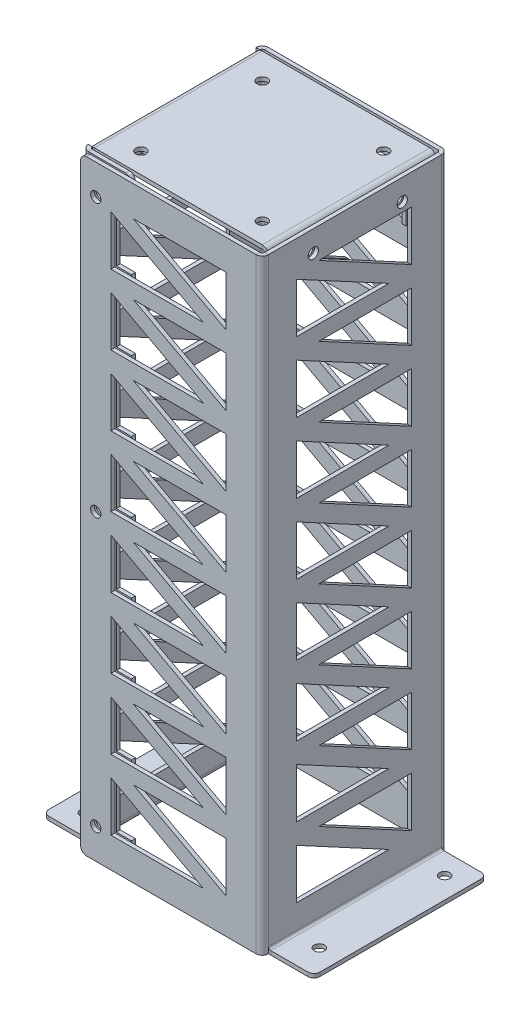
from build123d import *

# Parameters (mm, degrees)
SKETCH2_W                        = 60
SKETCH2_H                        = 200
BASE_FLANGE1_DEPTH               = 1.29
EDGE_FLANGE1_STRIP_W             = 6.684
EDGE_FLANGE1_STRIP_H             = 1.29
EDGE_FLANGE1_STRIP_CUT_DEPTH     = 200
EDGE_FLANGE1_DEPTH               = 200
EDGE_FLANGE2_STRIP_W             = 6.684
EDGE_FLANGE2_STRIP_H             = 1.29
EDGE_FLANGE2_STRIP_CUT_DEPTH     = 200
EDGE_FLANGE2_DEPTH               = 200
EDGE_FLANGE3_STRIP_W             = 6.684
EDGE_FLANGE3_STRIP_H             = 1.29
EDGE_FLANGE3_STRIP_CUT_DEPTH     = 200
EDGE_FLANGE3_DEPTH               = 200
EDGE_FLANGE4_STRIP_W             = 6.684
EDGE_FLANGE4_STRIP_H             = 1.29
EDGE_FLANGE4_STRIP_CUT_DEPTH     = 200
EDGE_FLANGE4_DEPTH               = 200
EDGE_FLANGE5_STRIP_W             = 6.684
EDGE_FLANGE5_STRIP_H             = 1.29
EDGE_FLANGE5_STRIP_CUT_DEPTH     = 57.186
EDGE_FLANGE5_DEPTH               = 57.186
EDGE_FLANGE6_STRIP_W             = 6.684
EDGE_FLANGE6_STRIP_H             = 1.29
EDGE_FLANGE6_STRIP_CUT_DEPTH     = 55.396
EDGE_FLANGE6_DEPTH               = 55.396
EDGE_FLANGE8_STRIP_W             = 6.684
EDGE_FLANGE8_STRIP_H             = 1.29
EDGE_FLANGE8_STRIP_CUT_DEPTH     = 55.396
EDGE_FLANGE8_DEPTH               = 55.396
EDGE_FLANGE9_START               = -59.238
EDGE_FLANGE9_DEPTH               = 55.396
EDGE_FLANGE9_2_DEPTH             = 55.396
SPEED_HOLE_DEPTH                 = 223.219405318
SPEED_HOLES_COUNT                = 8
SPEED_HOLES_PITCH                = 23.13
COPY_OF_SPEED_HOLES_COUNT        = 2
COPY_OF_SPEED_HOLES_ANGLE        = 90
COPY_OF_SPEED_HOLES_COPY_1_DEPTH = 223.219405318
COPY_OF_SPEED_HOLES_COPY_2_DEPTH = 223.219405318
COPY_OF_SPEED_HOLES_COPY_3_DEPTH = 223.219405318
COPY_OF_SPEED_HOLES_COPY_4_DEPTH = 223.219405318
COPY_OF_SPEED_HOLES_COPY_5_DEPTH = 223.219405318
COPY_OF_SPEED_HOLES_COPY_6_DEPTH = 223.219405318
COPY_OF_SPEED_HOLES_COPY_7_DEPTH = 223.219405318
M3_CLEARANCE_HOLE1_AT_2_COUNT    = 2
M3_CLEARANCE_HOLE1_AT_2_PITCH    = 41.396
M3_CLEARANCE_HOLE2_D             = 3.4
M3_START                         = -3.08
M3_CLEARANCE_HOLE3_OUTLINE_R     = 1.7
M3_CLEARANCE_HOLE3_DEPTH         = 3.08
M3_START_2                       = 56.92
M3_CLEARANCE_HOLE4_OUTLINE_R     = 1.7
M3_CLEARANCE_HOLE4_DEPTH         = 3.08
FILLET1_R                        = 2


# Read off the part's stored shape, not the designer's step: Edge-Flange9, M3 Clearance Hole3, M3 Clearance Hole4
# Sheet-metal steps are written as plain solids
with BuildPart() as part:
    # Sketch2 → Base-Flange1 (new body)
    with BuildSketch(Plane.XY):
        with Locations((30, 100)):
            Rectangle(SKETCH2_W, SKETCH2_H)
    extrude(amount=-BASE_FLANGE1_DEPTH)

    # Edge-Flange1 strip (across the edge) → Edge-Flange1 strip cut (cut)
    with BuildSketch(Plane(origin=(60, 200, -1.29), x_dir=(-1, 0, 0), z_dir=(0, -1, 0))):
        with Locations((-1.29, -0.645)):
            Rectangle(EDGE_FLANGE1_STRIP_W, EDGE_FLANGE1_STRIP_H)
    extrude(amount=EDGE_FLANGE1_STRIP_CUT_DEPTH, mode=Mode.SUBTRACT)

    # Edge-Flange1 section (across the edge) → Edge-Flange1 (add)
    with BuildSketch(Plane(origin=(60, 200, -1.29), x_dir=(-1, 0, 0), z_dir=(0, -1, 0))):
        with BuildLine():
            Line((0, 0.762), (0, 60))
            Line((0, 60), (1.29, 60))
            Line((1.29, 60), (1.29, 0.762))
            ThreePointArc((1.29, 0.762), (1.513184633, 0.223184633), (2.052, 0))
            Line((2.052, 0), (2.052, -1.29))
            ThreePointArc((2.052, -1.29), (0.601016885, -0.688983115), (0, 0.762))
        make_face()
    extrude(amount=EDGE_FLANGE1_DEPTH)

    # Edge-Flange2 strip (across the edge) → Edge-Flange2 strip cut (cut)
    with BuildSketch(Plane(origin=(58.71, 200, -61.29), x_dir=(0, 0, 1), z_dir=(0, -1, 0))):
        with Locations((-1.29, -0.645)):
            Rectangle(EDGE_FLANGE2_STRIP_W, EDGE_FLANGE2_STRIP_H)
    extrude(amount=EDGE_FLANGE2_STRIP_CUT_DEPTH, mode=Mode.SUBTRACT)

    # Edge-Flange2 section (across the edge) → Edge-Flange2 (add)
    with BuildSketch(Plane(origin=(58.71, 200, -61.29), x_dir=(0, 0, 1), z_dir=(0, -1, 0))):
        with BuildLine():
            Line((0, 0.762), (0, 60))
            Line((0, 60), (1.29, 60))
            Line((1.29, 60), (1.29, 0.762))
            ThreePointArc((1.29, 0.762), (1.513184633, 0.223184633), (2.052, 0))
            Line((2.052, 0), (2.052, -1.29))
            ThreePointArc((2.052, -1.29), (0.601016885, -0.688983115), (0, 0.762))
        make_face()
    extrude(amount=EDGE_FLANGE2_DEPTH)

    # Edge-Flange3 strip (across the edge) → Edge-Flange3 strip cut (cut)
    with BuildSketch(Plane(origin=(-1.29, 200, -60), x_dir=(1, 0, 0), z_dir=(0, -1, 0))):
        with Locations((-1.29, -0.645)):
            Rectangle(EDGE_FLANGE3_STRIP_W, EDGE_FLANGE3_STRIP_H)
    extrude(amount=EDGE_FLANGE3_STRIP_CUT_DEPTH, mode=Mode.SUBTRACT)

    # Edge-Flange3 section (across the edge) → Edge-Flange3 (add)
    with BuildSketch(Plane(origin=(-1.29, 200, -60), x_dir=(1, 0, 0), z_dir=(0, -1, 0))):
        with BuildLine():
            Line((0, 0.762), (0, 58.21))
            Line((0, 58.21), (1.29, 58.21))
            Line((1.29, 58.21), (1.29, 0.762))
            ThreePointArc((1.29, 0.762), (1.513184633, 0.223184633), (2.052, 0))
            Line((2.052, 0), (2.052, -1.29))
            ThreePointArc((2.052, -1.29), (0.601016885, -0.688983115), (0, 0.762))
        make_face()
    extrude(amount=EDGE_FLANGE3_DEPTH)

    # Edge-Flange4 strip (across the edge) → Edge-Flange4 strip cut (cut)
    with BuildSketch(Plane(origin=(0, 200, -1.79), x_dir=(0, 0, -1), z_dir=(0, -1, 0))):
        with Locations((-1.29, -0.645)):
            Rectangle(EDGE_FLANGE4_STRIP_W, EDGE_FLANGE4_STRIP_H)
    extrude(amount=EDGE_FLANGE4_STRIP_CUT_DEPTH, mode=Mode.SUBTRACT)

    # Edge-Flange4 section (across the edge) → Edge-Flange4 (add)
    with BuildSketch(Plane(origin=(0, 200, -1.79), x_dir=(0, 0, -1), z_dir=(0, -1, 0))):
        with BuildLine():
            Line((0, 0.762), (0, 15))
            Line((0, 15), (1.29, 15))
            Line((1.29, 15), (1.29, 0.762))
            ThreePointArc((1.29, 0.762), (1.513184633, 0.223184633), (2.052, 0))
            Line((2.052, 0), (2.052, -1.29))
            ThreePointArc((2.052, -1.29), (0.601016885, -0.688983115), (0, 0.762))
        make_face()
    extrude(amount=EDGE_FLANGE4_DEPTH)

    # Edge-Flange5 strip (across the edge) → Edge-Flange5 strip cut (cut)
    with BuildSketch(Plane(origin=(60, 0, -2.052), x_dir=(0, 1, 0), z_dir=(0, 0, -1))):
        with Locations((-1.29, -0.645)):
            Rectangle(EDGE_FLANGE5_STRIP_W, EDGE_FLANGE5_STRIP_H)
    extrude(amount=EDGE_FLANGE5_STRIP_CUT_DEPTH, mode=Mode.SUBTRACT)

    # Edge-Flange5 section (across the edge) → Edge-Flange5 (add)
    with BuildSketch(Plane(origin=(60, 0, -2.052), x_dir=(0, 1, 0), z_dir=(0, 0, -1))):
        with BuildLine():
            Line((0, 0.762), (0, 15))
            Line((0, 15), (1.29, 15))
            Line((1.29, 15), (1.29, 0.762))
            ThreePointArc((1.29, 0.762), (1.513184633, 0.223184633), (2.052, 0))
            Line((2.052, 0), (2.052, -1.29))
            ThreePointArc((2.052, -1.29), (0.601016885, -0.688983115), (0, 0.762))
        make_face()
    extrude(amount=EDGE_FLANGE5_DEPTH)

    # Edge-Flange6 strip (across the edge) → Edge-Flange6 strip cut (cut)
    with BuildSketch(Plane(origin=(-1.29, 0, -59.238), x_dir=(0, 1, 0), z_dir=(0, 0, 1))):
        with Locations((-1.29, -0.645)):
            Rectangle(EDGE_FLANGE6_STRIP_W, EDGE_FLANGE6_STRIP_H)
    extrude(amount=EDGE_FLANGE6_STRIP_CUT_DEPTH, mode=Mode.SUBTRACT)

    # Edge-Flange6 section (across the edge) → Edge-Flange6 (add)
    with BuildSketch(Plane(origin=(-1.29, 0, -59.238), x_dir=(0, 1, 0), z_dir=(0, 0, 1))):
        with BuildLine():
            Line((0, 0.762), (0, 15))
            Line((0, 15), (1.29, 15))
            Line((1.29, 15), (1.29, 0.762))
            ThreePointArc((1.29, 0.762), (1.513184633, 0.223184633), (2.052, 0))
            Line((2.052, 0), (2.052, -1.29))
            ThreePointArc((2.052, -1.29), (0.601016885, -0.688983115), (0, 0.762))
        make_face()
    extrude(amount=EDGE_FLANGE6_DEPTH)

    # Edge-Flange8 strip (across the edge) → Edge-Flange8 strip cut (cut)
    with BuildSketch(Plane(origin=(0, 200, -59.238), x_dir=(0, -1, 0), z_dir=(0, 0, 1))):
        with Locations((-1.29, -0.645)):
            Rectangle(EDGE_FLANGE8_STRIP_W, EDGE_FLANGE8_STRIP_H)
    extrude(amount=EDGE_FLANGE8_STRIP_CUT_DEPTH, mode=Mode.SUBTRACT)

    # Edge-Flange8 section (across the edge) → Edge-Flange8 (add)
    with BuildSketch(Plane(origin=(0, 200, -59.238), x_dir=(0, -1, 0), z_dir=(0, 0, 1))):
        with BuildLine():
            Line((0, 0.762), (0, 58.21))
            Line((0, 58.21), (1.29, 58.21))
            Line((1.29, 58.21), (1.29, 0.762))
            ThreePointArc((1.29, 0.762), (1.513184633, 0.223184633), (2.052, 0))
            Line((2.052, 0), (2.052, -1.29))
            ThreePointArc((2.052, -1.29), (0.601016885, -0.688983115), (0, 0.762))
        make_face()
    extrude(amount=EDGE_FLANGE8_DEPTH)

    # Edge-Flange9 outline → Edge-Flange9 (cut)
    with BuildSketch(Plane.XY.offset(EDGE_FLANGE9_START)):
        with BuildLine():
            ThreePointArc((56.158, 200), (57.308452085, 199.647165678), (58.063271634, 198.71))
            Line((58.063271634, 198.71), (58.21, 198.71))
            Line((58.21, 198.71), (58.21, 200))
            Line((58.21, 200), (56.158, 200))
        make_face()
    extrude(amount=EDGE_FLANGE9_DEPTH, mode=Mode.SUBTRACT)

    # Edge-Flange9 2 outline → Edge-Flange9 2 (add)
    with BuildSketch(Plane.XY.offset(EDGE_FLANGE9_START)):
        with BuildLine():
            Line((58.21, 183.71), (58.21, 197.948))
            ThreePointArc((58.21, 197.948), (58.172984044, 198.335999102), (58.063271634, 198.71))
            Line((58.063271634, 198.71), (56.158, 198.71))
            ThreePointArc((56.158, 198.71), (56.696815367, 198.486815367), (56.92, 197.948))
            Line((56.92, 197.948), (56.92, 183.71))
            Line((56.92, 183.71), (58.21, 183.71))
        make_face()
    extrude(amount=EDGE_FLANGE9_2_DEPTH)

    # Sketch37 → Speed Hole (cut, through all)
    with BuildSketch(Plane.XY):
        Polygon((47.948, 190), (17.416327699, 190), (47.948, 173.56047029), align=None)
        Polygon((40.531672301, 171.875), (10, 188.31452971), (10, 171.875), align=None)
    speed_hole = extrude(amount=-SPEED_HOLE_DEPTH, mode=Mode.SUBTRACT)

    # Speed Holes: Speed Hole ×8
    with Locations(*[(0, -i * SPEED_HOLES_PITCH, 0) for i in range(1, SPEED_HOLES_COUNT)]):
        add(speed_hole, mode=Mode.SUBTRACT)

    # Copy of Speed Holes: Speed Hole ×2 about axis
    copy_of_speed_holes_axis = Axis((29.355, -7.8454, -30.645), (0, 1, 0))
    for i in range(1, COPY_OF_SPEED_HOLES_COUNT):
        add(speed_hole.rotate(copy_of_speed_holes_axis, i * COPY_OF_SPEED_HOLES_ANGLE / (COPY_OF_SPEED_HOLES_COUNT - 1)), mode=Mode.SUBTRACT)

    # Copy of Speed Holes copy 1 sketch → Copy of Speed Holes copy 1 (cut, through all)
    with BuildSketch(Plane(origin=(60, -23.13, -1.29), x_dir=(0, 0, -1), z_dir=(1, 0, 0))):
        Polygon((47.948, 190), (17.416327699, 190), (47.948, 173.56047029), align=None)
        Polygon((40.531672301, 171.875), (10, 188.31452971), (10, 171.875), align=None)
    extrude(amount=-COPY_OF_SPEED_HOLES_COPY_1_DEPTH, mode=Mode.SUBTRACT)

    # Copy of Speed Holes copy 2 sketch → Copy of Speed Holes copy 2 (cut, through all)
    with BuildSketch(Plane(origin=(60, -46.26, -1.29), x_dir=(0, 0, -1), z_dir=(1, 0, 0))):
        Polygon((47.948, 190), (17.416327699, 190), (47.948, 173.56047029), align=None)
        Polygon((40.531672301, 171.875), (10, 188.31452971), (10, 171.875), align=None)
    extrude(amount=-COPY_OF_SPEED_HOLES_COPY_2_DEPTH, mode=Mode.SUBTRACT)

    # Copy of Speed Holes copy 3 sketch → Copy of Speed Holes copy 3 (cut, through all)
    with BuildSketch(Plane(origin=(60, -69.39, -1.29), x_dir=(0, 0, -1), z_dir=(1, 0, 0))):
        Polygon((47.948, 190), (17.416327699, 190), (47.948, 173.56047029), align=None)
        Polygon((40.531672301, 171.875), (10, 188.31452971), (10, 171.875), align=None)
    extrude(amount=-COPY_OF_SPEED_HOLES_COPY_3_DEPTH, mode=Mode.SUBTRACT)

    # Copy of Speed Holes copy 4 sketch → Copy of Speed Holes copy 4 (cut, through all)
    with BuildSketch(Plane(origin=(60, -92.52, -1.29), x_dir=(0, 0, -1), z_dir=(1, 0, 0))):
        Polygon((47.948, 190), (17.416327699, 190), (47.948, 173.56047029), align=None)
        Polygon((40.531672301, 171.875), (10, 188.31452971), (10, 171.875), align=None)
    extrude(amount=-COPY_OF_SPEED_HOLES_COPY_4_DEPTH, mode=Mode.SUBTRACT)

    # Copy of Speed Holes copy 5 sketch → Copy of Speed Holes copy 5 (cut, through all)
    with BuildSketch(Plane(origin=(60, -115.65, -1.29), x_dir=(0, 0, -1), z_dir=(1, 0, 0))):
        Polygon((47.948, 190), (17.416327699, 190), (47.948, 173.56047029), align=None)
        Polygon((40.531672301, 171.875), (10, 188.31452971), (10, 171.875), align=None)
    extrude(amount=-COPY_OF_SPEED_HOLES_COPY_5_DEPTH, mode=Mode.SUBTRACT)

    # Copy of Speed Holes copy 6 sketch → Copy of Speed Holes copy 6 (cut, through all)
    with BuildSketch(Plane(origin=(60, -138.78, -1.29), x_dir=(0, 0, -1), z_dir=(1, 0, 0))):
        Polygon((47.948, 190), (17.416327699, 190), (47.948, 173.56047029), align=None)
        Polygon((40.531672301, 171.875), (10, 188.31452971), (10, 171.875), align=None)
    extrude(amount=-COPY_OF_SPEED_HOLES_COPY_6_DEPTH, mode=Mode.SUBTRACT)

    # Copy of Speed Holes copy 7 sketch → Copy of Speed Holes copy 7 (cut, through all)
    with BuildSketch(Plane(origin=(60, -161.91, -1.29), x_dir=(0, 0, -1), z_dir=(1, 0, 0))):
        Polygon((47.948, 190), (17.416327699, 190), (47.948, 173.56047029), align=None)
        Polygon((40.531672301, 171.875), (10, 188.31452971), (10, 171.875), align=None)
    extrude(amount=-COPY_OF_SPEED_HOLES_COPY_7_DEPTH, mode=Mode.SUBTRACT)

    # Sketch39 → M3 Clearance Hole1 (revolve, cut)
    with BuildSketch(Plane(origin=(-9.29, 1.29, -52.238), x_dir=(0, 0, 1), z_dir=(1, 0, 0))):
        Polygon((0, 0), (0, 13.021463052), (1.7, 12), (1.7, 0), align=None)
    m3_clearance_hole1 = revolve(axis=Axis((-9.29, 7.64, -52.238), (0, -1, 0)), mode=Mode.SUBTRACT)

    # M3 Clearance Hole1 at 2: M3 Clearance Hole1 ×2
    with Locations(*[(0, 0, i * M3_CLEARANCE_HOLE1_AT_2_PITCH) for i in range(1, M3_CLEARANCE_HOLE1_AT_2_COUNT)]):
        add(m3_clearance_hole1, mode=Mode.SUBTRACT)

    # Copy of M3 Hole1: M3 Clearance Hole1 across plane
    add(m3_clearance_hole1.mirror(Plane.ZY.offset(-29.355)), mode=Mode.SUBTRACT)

    # Copy of M3 Hole1 copy 1 sketch → Copy of M3 Hole1 copy 1 (revolve, cut)
    with BuildSketch(Plane(origin=(68, 1.29, -10.842), x_dir=(0, 0, 1), z_dir=(-1, 0, 0))):
        Polygon((0, 0), (0, -13.021463052), (1.7, -12), (1.7, 0), align=None)
    revolve(axis=Axis((68, 7.64, -10.842), (0, 1, 0)), mode=Mode.SUBTRACT)

    # M3 Clearance Hole2 (through all)
    with Locations(Plane(origin=(0, 200, 0), x_dir=(1, 0, 0), z_dir=(0, 1, 0))):
        with Locations((9.311016885, 50.688983115), (49.398983115, 50.688983115), (49.398983115, 10.601016885), (9.311016885, 10.601016885)):
            Hole(M3_CLEARANCE_HOLE2_D / 2)

    # M3 Clearance Hole3 outline → M3 Clearance Hole3 (cut)
    with BuildSketch(Plane.XY.offset(M3_START)):
        with Locations((5, 100)):
            Circle(M3_CLEARANCE_HOLE3_OUTLINE_R)
        with Locations((5, 10)):
            Circle(M3_CLEARANCE_HOLE3_OUTLINE_R)
        with Locations((5, 190)):
            Circle(M3_CLEARANCE_HOLE3_OUTLINE_R)
    extrude(amount=M3_CLEARANCE_HOLE3_DEPTH, mode=Mode.SUBTRACT)

    # M3 Clearance Hole4 outline → M3 Clearance Hole4 (cut)
    with BuildSketch(Plane.YZ.offset(M3_START_2)):
        with Locations((193, -46.238)):
            Circle(M3_CLEARANCE_HOLE4_OUTLINE_R)
        with Locations((193, -16.842)):
            Circle(M3_CLEARANCE_HOLE4_OUTLINE_R)
    extrude(amount=M3_CLEARANCE_HOLE4_DEPTH, mode=Mode.SUBTRACT)

    # Fillet1
    fillet1_edges = [part.edges().sort_by_distance(p)[0] for p in [
        (15, 200, -2.435),
        (15, 0, -2.435),
        (75, 0.645, -2.052),
        (75, 0.645, -59.238),
        (-16.29, 0.645, -59.238),
        (-16.29, 0.645, -3.842),
        (57.565, 183.71, -59.238),
        (57.565, 183.71, -3.842),
        (0, 200, -0.645),
        (0, 0, -0.645),
    ]]
    fillet(fillet1_edges, radius=FILLET1_R)


solid = part.part
